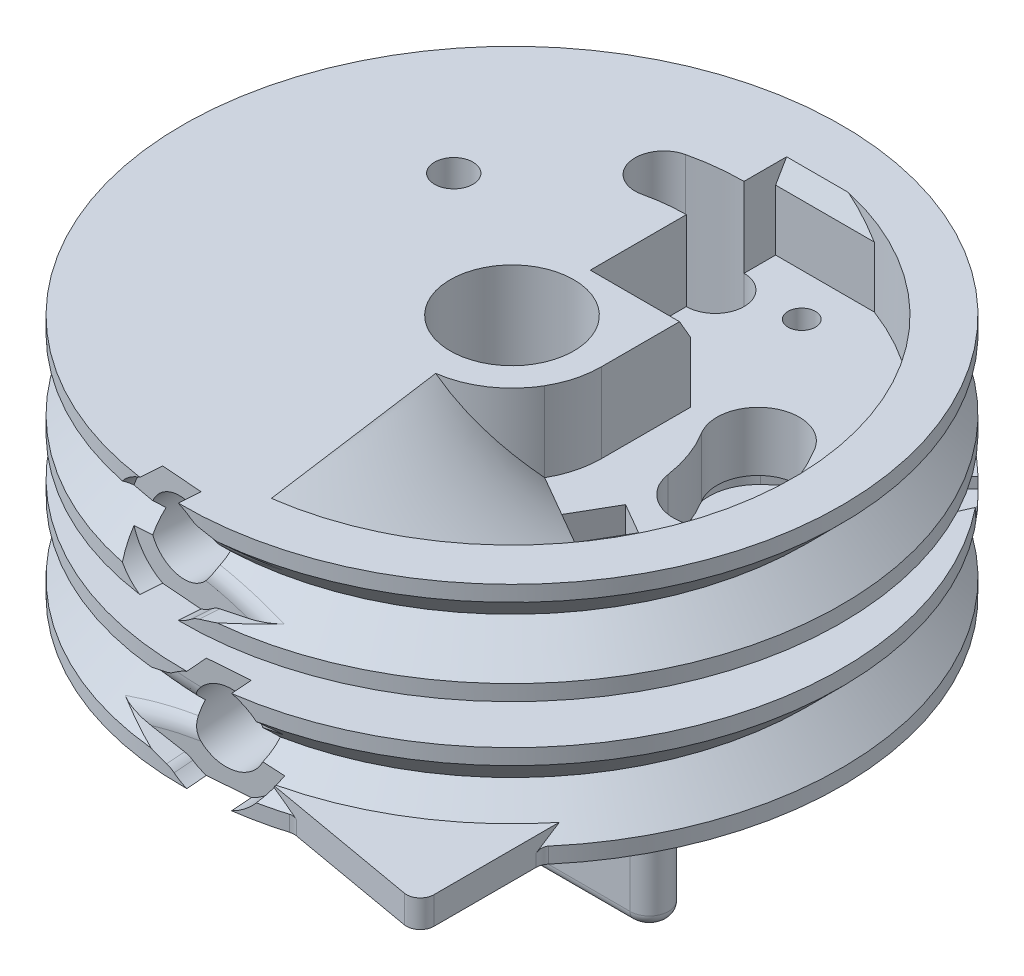
from build123d import *

# Parameters (mm, degrees)
SKETCH5_R                     = 18.25
BOSS_EXTRUDE1_DEPTH           = 2.7
FILLET1_R                     = 1.4
CUT_EXTRUDE1_DEPTH            = 3.5
SKETCH8_R                     = 1.4
CUT_EXTRUDE2_DEPTH            = 35.576870882
SKETCH9_R                     = 4.5
SLEEVE_BEARING_BORE_DEPTH     = 36.412003615
SCREW_HEAD_POCKET_DEPTH       = 36.412003615
SKETCH15_R                    = 4
WIRE_ROPE_CINCH_DEPTH         = 1.6
SKETCH16_R                    = 2.55
HEAT_SET_INSERT_HOLE_DEPTH    = 7
LIMIT_SWITCH_SLOT_DEPTH       = 36.412003779
LIMIT_START                   = -5.8
LIMIT_SWITCH_POCKET_DEPTH     = 5.8
SKETCH35_R                    = 1
LIMIT_SWITCH_HOLES_DEPTH      = 35.433123744
WIRE_RAMP_PITCH               = 40
WIRE_RAMP_HEIGHT              = 32
WIRE_RAMP_RADIUS              = 6.5
WIRE_RAMP_START_ANGLE         = 60
SKETCH36_W                    = 14
SKETCH36_H                    = 5.8
CUT_EXTRUDE17_DEPTH           = 35.433123744
CUT_EXTRUDE18_DEPTH           = 2.5
FILLET2_R                     = 1
BOSS_EXTRUDE2_DEPTH           = 5.8
CHAMFER2_SIZE                 = 0.8
CHAMFER2_SIZE2                = 1.385640646
SKETCH19_R                    = 3.1
CUT_EXTRUDE9_DEPTH            = 7.4
HOME_SWITCH_TAB_DEPTH         = 2
SKETCH17_R                    = 4
CUT_EXTRUDE7_DEPTH            = 1.6
SKETCH18_R                    = 2.55
CUT_EXTRUDE8_DEPTH            = 7
SKETCH21_R                    = 9.575
CUT_EXTRUDE13_DEPTH           = 5
SKETCH24_W                    = 1.7
SKETCH24_H                    = 23.536394427
M3_CLEARANCE_HOLE1_AT_2_COUNT = 2
M3_CLEARANCE_HOLE1_AT_2_PITCH = 8.980256121
M3_CLEARANCE_HOLE1_AT_3_COUNT = 2
M3_CLEARANCE_HOLE1_AT_3_PITCH = 12.7
M3_CLEARANCE_HOLE1_AT_4_COUNT = 2
M3_CLEARANCE_HOLE1_AT_4_PITCH = 8.980256121
SET_SCREW_HOLE_REACH          = 57.415
SET_SCREW_HOLE_END_RADIUS     = 9.575
SKETCH25_R                    = 1.7
CUT_EXTRUDE15_DEPTH           = 0.8
SKETCH27_R                    = 1.4
CUT_EXTRUDE16_DEPTH           = 37.30359691
FILLET3_R                     = 1
CUT_EXTRUDE20_DEPTH           = 54.980696213
FILLET4_R                     = 1.6
CUT_EXTRUDE21_DEPTH           = 54.980696213
FILLET5_R                     = 1.6
SKETCH45_R                    = 1.6
BOSS_EXTRUDE3_DEPTH           = 3
BOSS_EXTRUDE4_DEPTH           = 12
FILLET6_START                 = -16.3000001
FILLET6_OUTLINE_R             = 1.6
FILLET6_DEPTH                 = 3.0000001
FILLET6_START_2               = -8
FILLET6_2_DEPTH               = 16
SKETCH47_R                    = 3
CUT_EXTRUDE22_DEPTH           = 41.171238063
FILLET7_R                     = 0.8
CHAMFER5_SIZE                 = 3


with BuildPart() as part:
    # Sketch4 → Revolve1 (revolve)
    with BuildSketch(Plane(origin=(0, 0, 0), x_dir=(0, 0, -1), z_dir=(1, 0, 0))):
        Polygon((0, 0), (-24, 0), (-24, 1.138733992), (-21.438733992, 3.7), (-24, 6.261266008), (-24, 7.4), (0, 7.4), align=None)
    revolve(axis=Axis((0, 7.4, 0), (0, -1, 0)))

    # Sketch5 → Boss-Extrude1 (add)
    with BuildSketch(Plane.XZ):
        with Locations(Location((0, 0, 0), (0, 0, 270))):
            Circle(SKETCH5_R)
    extrude(amount=BOSS_EXTRUDE1_DEPTH)

    # Fillet1
    fillet1_edges = [part.edges().sort_by_distance(p)[0] for p in [
        (0, 0, 18.25),
    ]]
    fillet(fillet1_edges, radius=FILLET1_R)

    # Sketch7 → Cut-Extrude1 (cut)
    with BuildSketch(Plane.XZ.offset(2.7)):
        with BuildLine():
            Line((-14.273064383, -14.721842042), (-8.634125379, -9.480067375))
            ThreePointArc((-8.634125379, -9.480067375), (-8.991329737, -3.914860926), (-14.37293646, -5.376855059))
            Line((-14.37293646, -5.376855059), (-21.564176599, -21.4994233))
            Line((-21.564176599, -21.4994233), (-14.273064383, -14.721842042))
        make_face()
    extrude(amount=-CUT_EXTRUDE1_DEPTH, mode=Mode.SUBTRACT)

    # Sketch8 → Cut-Extrude2 (cut, through all)
    with BuildSketch(Plane.XZ.offset(-0.8)):
        with Locations(Location((-11.085159379, -6.843320833, 0), (0, 0, 270))):
            Circle(SKETCH8_R)
    extrude(amount=-CUT_EXTRUDE2_DEPTH, mode=Mode.SUBTRACT)

    # Sketch9 → sleeve bearing bore (cut, through all)
    with BuildSketch(Plane.XZ.offset(2.7)):
        with Locations(Location((0, 0, 0), (0, 0, 270))):
            Circle(SKETCH9_R)
    extrude(amount=-SLEEVE_BEARING_BORE_DEPTH, mode=Mode.SUBTRACT)

    # Sketch11 → screw head pocket (cut, through all)
    with BuildSketch(Plane.XZ.offset(2.7)):
        with BuildLine():
            ThreePointArc((13.637902876, -8.41923347), (15.058344169, -5.488365693), (15.856954091, -2.330856931))
            ThreePointArc((15.856954091, -2.330856931), (13.325138395, 1.073538652), (9.920742813, -1.458277044))
            ThreePointArc((9.920742813, -1.458277044), (9.421100599, -3.433740439), (8.532415883, -5.267408196))
            ThreePointArc((8.532415883, -5.267408196), (9.509246742, -9.396064329), (13.637902876, -8.41923347))
        make_face()
    extrude(amount=-SCREW_HEAD_POCKET_DEPTH, mode=Mode.SUBTRACT)

    # Sketch15 → Wire Rope Cinch (cut)
    with BuildSketch(Plane(origin=(-1.830283843, 0, 23.930107836), x_dir=(0.9970878265112338, 0, 0.07626182677528456), z_dir=(-0.07626182677528456, 0, 0.997087826511234))):
        with Locations((0, 3.7)):
            Circle(SKETCH15_R)
    extrude(amount=-WIRE_ROPE_CINCH_DEPTH, mode=Mode.SUBTRACT)

    # Sketch16 → Heat Set Insert Hole (cut)
    with BuildSketch(Plane(origin=(-1.70826492, 0, 22.334767314), x_dir=(0.9970878265112338, 0, 0.07626182677528458), z_dir=(-0.07626182677528458, 0, 0.997087826511234))):
        with Locations((0, 3.7)):
            Circle(SKETCH16_R)
    extrude(amount=-HEAT_SET_INSERT_HOLE_DEPTH, mode=Mode.SUBTRACT)

    # Sketch33 → Limit Switch Slot (cut, through all)
    with BuildSketch(Plane.XZ.offset(2.7)):
        with BuildLine():
            ThreePointArc((-2.879883094, -12.369166236), (-1.449411744, -12.617020472), (0, -12.7))
            ThreePointArc((0, -12.7), (2.1, -14.8), (0, -16.9))
            ThreePointArc((0, -16.9), (-1.928744762, -16.789578424), (-3.832285377, -16.459756644))
            ThreePointArc((-3.832285377, -16.459756644), (-5.40137944, -13.938260298), (-2.879883094, -12.369166236))
        make_face()
    extrude(amount=-LIMIT_SWITCH_SLOT_DEPTH, mode=Mode.SUBTRACT)

    # Sketch34 → Limit Switch Pocket (cut)
    with BuildSketch(Plane(origin=(0, 7.4, 0), x_dir=(1, 0, 0), z_dir=(0, 1, 0)).offset(LIMIT_START)):
        with BuildLine():
            Line((0, 6.5), (0, 12.7))
            ThreePointArc((0, 12.7), (-1.449411744, 12.617020472), (-2.879883094, 12.369166236))
            ThreePointArc((-2.879883094, 12.369166236), (-5.40137944, 13.938260298), (-3.832285377, 16.459756644))
            ThreePointArc((-3.832285377, 16.459756644), (-1.928744762, 16.789578424), (0, 16.9))
            Line((0, 16.9), (0, 19.2))
            Line((0, 19.2), (7.184010022, 19.2))
            ThreePointArc((7.184010022, 19.2), (19.294966587, 6.924901761), (17.753520778, -10.25))
            Line((17.753520778, -10.25), (5.629165125, -3.25))
            ThreePointArc((5.629165125, -3.25), (5.629165125, 3.25), (0, 6.5))
        make_face()
    extrude(amount=LIMIT_SWITCH_POCKET_DEPTH, mode=Mode.SUBTRACT)

    # Sketch35 → Limit Switch Holes (cut, through all)
    with BuildSketch(Plane(origin=(0, 1.6, 0), x_dir=(1, 0, 0), z_dir=(0, 1, 0))):
        with Locations(Location((5, 16.1, 0), (0, 0, 270))):
            Circle(SKETCH35_R)
    extrude(amount=-LIMIT_SWITCH_HOLES_DEPTH, mode=Mode.SUBTRACT)

    # Wire Ramp: sweep along a helix
    with BuildLine() as wire_ramp_path:
        add(Helix(WIRE_RAMP_PITCH, WIRE_RAMP_HEIGHT, WIRE_RAMP_RADIUS, center=(0, 1.6, 0), direction=(0, 1, 0), lefthand=True, mode=Mode.PRIVATE).rotate(Axis((0, 1.6, 0), (0, 1, 0)), WIRE_RAMP_START_ANGLE))
    # Sketch36 → Wire Ramp (sweep, cut)
    with BuildSketch(Plane(origin=(0, 0, 0), x_dir=(-0.8660254037844367, 0, -0.5000000000000036), z_dir=(0.5000000000000036, 0, -0.8660254037844367))):
        with Locations((-13.5, 4.5)):
            Rectangle(SKETCH36_W, SKETCH36_H)
    sweep(path=wire_ramp_path.line, is_frenet=True, mode=Mode.SUBTRACT)

    # Sketch38 → Cut-Extrude17 (cut, through all)
    with BuildSketch(Plane(origin=(0, 1.6, 0), x_dir=(1, 0, 0), z_dir=(0, 1, 0))):
        Polygon((10.825317547, -6.25), (12.525317547, -3.305513627), (10.273651497, -2.005513627), (8.573651497, -4.95), align=None)
        Polygon((14.257368355, -4.305513627), (16.509034405, -5.605513627), (14.809034405, -8.55), (12.557368355, -7.25), align=None)
    extrude(amount=-CUT_EXTRUDE17_DEPTH, mode=Mode.SUBTRACT)

    # Sketch39 → Cut-Extrude18 (cut)
    with BuildSketch(Plane.XZ.offset(2.7)):
        Polygon((12.557368355, 7.25), (10.825317547, 6.25), (12.525317547, 3.305513627), (14.257368355, 4.305513627), align=None)
    extrude(amount=-CUT_EXTRUDE18_DEPTH, mode=Mode.SUBTRACT)

    # Fillet2
    fillet2_edges = [part.edges().sort_by_distance(p)[0] for p in [
        (13.407368355, -0.2, 5.777756814),
        (11.675317547, -0.2, 4.777756814),
    ]]
    fillet(fillet2_edges, radius=FILLET2_R - 0.0001)  # a hair under: the kernel refuses the full size

    # Sketch41 → Boss-Extrude2 (add)
    with BuildSketch(Plane(origin=(0, 1.6, 0), x_dir=(1, 0, 0), z_dir=(0, 1, 0))):
        with BuildLine():
            Line((0, 6.5), (6.5, 6.5))
            Line((6.5, 6.5), (6.5, 0))
            ThreePointArc((6.5, 0), (4.596194078, 4.596194078), (0, 6.5))
        make_face()
    extrude(amount=BOSS_EXTRUDE2_DEPTH)

    # Chamfer2
    chamfer2_edges = [part.edges().sort_by_distance(p)[0] for p in [
        (3.592005011, 7.4, -19.2),
        (3.25, 7.4, -6.5),
    ]]
    chamfer2_side = [part.faces().sort_by_distance(p)[0] for p in [
        (-4.600470931, 7.4, 0.385167861),
    ]]
    chamfer(chamfer2_edges, length=CHAMFER2_SIZE, length2=CHAMFER2_SIZE2, reference=chamfer2_side[0])

    # Sketch43 → Cut-Extrude20 (cut, through all)
    with BuildSketch(Plane(origin=(-1.70826492, 0, 22.334767314), x_dir=(0.997087826511234, 0, 0.07626182677528455), z_dir=(-0.07626182677528455, 0, 0.997087826511234))):
        Polygon((10, 4.7), (10, 2.7), (0, 0), (0, 7.4), align=None)
    extrude(amount=CUT_EXTRUDE20_DEPTH, mode=Mode.SUBTRACT)

    # Fillet4
    fillet4_edges = [part.edges().sort_by_distance(p)[0] for p in [
        (3.484452903, 2.141298121, 22.731930068),
        (3.484452903, 5.258701879, 22.731930068),
        (0.897574071, 0.720615042, 23.261761405),
        (0.897574071, 6.679384958, 23.261761405),
    ]]
    fillet(fillet4_edges, radius=FILLET4_R)


with BuildPart() as body_2:
    # Sketch13 → Revolve2 (revolve)
    with BuildSketch(Plane(origin=(0, 0, 0), x_dir=(0, 0, -1), z_dir=(1, 0, 0))):
        Polygon((0, -2.9), (0, -10.3), (-24, -10.3), (-24, -9.161266008), (-21.438733992, -6.6), (-24, -4.038733992), (-24, -2.9), align=None)
    revolve(axis=Axis((0, -2.9, 0), (0, -1, 0)))

    # Sketch19 → Cut-Extrude9 (cut)
    with BuildSketch(Plane.XZ.offset(10.3)):
        with Locations(Location((0, 0, 0), (0, 0, 270))):
            Circle(SKETCH19_R)
    extrude(amount=-CUT_EXTRUDE9_DEPTH, mode=Mode.SUBTRACT)

    # Sketch42 → home switch tab (add)
    with BuildSketch(Plane.XZ.offset(10.3)):
        with BuildLine():
            Line((18, 15.874507866), (18, 24.874507866))
            Line((18, 24.874507866), (7.044720563, 22.942796521))
            Line((7.044720563, 22.942796521), (5.075105057, 22.595500165))
            ThreePointArc((5.075105057, 22.595500165), (12.215292402, 19.674855796), (18, 14.570975227))
            Line((18, 14.570975227), (18, 15.874507866))
        make_face()
    extrude(amount=-HOME_SWITCH_TAB_DEPTH)

    # Sketch17 → Cut-Extrude7 (cut)
    with BuildSketch(Plane(origin=(1.830283843, 0, 23.930107836), x_dir=(0.997087826511234, 0, -0.0762618267752854), z_dir=(0.0762618267752854, 0, 0.997087826511234))):
        with Locations((0, -6.6)):
            Circle(SKETCH17_R)
    extrude(amount=-CUT_EXTRUDE7_DEPTH, mode=Mode.SUBTRACT)

    # Sketch18 → Cut-Extrude8 (cut)
    with BuildSketch(Plane(origin=(1.70826492, 0, 22.334767314), x_dir=(0.997087826511234, 0, -0.07626182677528541), z_dir=(0.07626182677528541, 0, 0.997087826511234))):
        with Locations((0, -6.6)):
            Circle(SKETCH18_R)
    extrude(amount=-CUT_EXTRUDE8_DEPTH, mode=Mode.SUBTRACT)

    # Sketch21 → Cut-Extrude13 (cut)
    with BuildSketch(Plane.XZ.offset(2.9)):
        with Locations(Location((0, 0, 0), (0, 0, 270))):
            Circle(SKETCH21_R)
    extrude(amount=CUT_EXTRUDE13_DEPTH, mode=Mode.SUBTRACT)

    # Sketch24 → M3 Clearance Hole1 (revolve, cut)
    with BuildSketch(Plane(origin=(4.490128061, -10.3, -4.490128061), x_dir=(0, 0, -1), z_dir=(1, 0, 0))):
        with Locations((0.85, 11.768197214)):
            Rectangle(SKETCH24_W, SKETCH24_H)
    m3_clearance_hole1 = revolve(axis=Axis((4.490128061, -16.65, -4.490128061), (0, 1, 0)), mode=Mode.SUBTRACT)

    # M3 Clearance Hole1 at 2: M3 Clearance Hole1 ×2
    with Locations(*[(0, 0, i * M3_CLEARANCE_HOLE1_AT_2_PITCH) for i in range(1, M3_CLEARANCE_HOLE1_AT_2_COUNT)]):
        add(m3_clearance_hole1, mode=Mode.SUBTRACT)

    # M3 Clearance Hole1 at 3: M3 Clearance Hole1 ×2
    with Locations(*[Vector(-0.7071067811865491, 0, 0.707106781186546) * (i * M3_CLEARANCE_HOLE1_AT_3_PITCH) for i in range(1, M3_CLEARANCE_HOLE1_AT_3_COUNT)]):
        add(m3_clearance_hole1, mode=Mode.SUBTRACT)

    # M3 Clearance Hole1 at 4: M3 Clearance Hole1 ×2
    with Locations(*[(-i * M3_CLEARANCE_HOLE1_AT_4_PITCH, 0, 0) for i in range(1, M3_CLEARANCE_HOLE1_AT_4_COUNT)]):
        add(m3_clearance_hole1, mode=Mode.SUBTRACT)

    # Set Screw Hole: up to this cylinder (the profile starts outside it)
    set_screw_hole_end = Plane(origin=(0, -5.4, 0), z_dir=(0, 1, 0)) * Cylinder(SET_SCREW_HOLE_END_RADIUS, 134.98, mode=Mode.PRIVATE)
    # Sketch25 → Set Screw Hole (cut, up to the surface)
    with BuildSketch(Plane(origin=(0, 0, -24), x_dir=(-1, 0, 0), z_dir=(0, 0, -1)), mode=Mode.PRIVATE) as set_screw_hole_sk1:
        with Locations(Location((0, -5.4, 0), (0, 0, 90))):
            Circle(SKETCH25_R)
    set_screw_hole_tool1 = extrude(set_screw_hole_sk1.sketch, amount=-SET_SCREW_HOLE_REACH, mode=Mode.PRIVATE) - set_screw_hole_end
    add(set_screw_hole_tool1.solids().sort_by_distance((0, -5.4, -24))[0], mode=Mode.SUBTRACT)

    # Sketch26 → Cut-Extrude15 (cut)
    with BuildSketch(Plane(origin=(0, -2.9, 0), x_dir=(1, 0, 0), z_dir=(0, 1, 0))):
        with BuildLine():
            Line((14.37293646, 5.376855059), (21.564176599, 21.4994233))
            Line((21.564176599, 21.4994233), (8.634125379, 9.480067375))
            ThreePointArc((8.634125379, 9.480067375), (8.991329737, 3.914860926), (14.37293646, 5.376855059))
        make_face()
    extrude(amount=-CUT_EXTRUDE15_DEPTH, mode=Mode.SUBTRACT)

    # Sketch27 → Cut-Extrude16 (cut, through all)
    with BuildSketch(Plane(origin=(0, -3.7, 0), x_dir=(1, 0, 0), z_dir=(0, 1, 0))):
        with Locations(Location((11.085159379, 6.843320833, 0), (0, 0, 270))):
            Circle(SKETCH27_R)
    extrude(amount=-CUT_EXTRUDE16_DEPTH, mode=Mode.SUBTRACT)

    # Fillet3
    fillet3_edges = [body_2.edges().sort_by_distance(p)[0] for p in [
        (7.044720563, -9.730633004, 22.942796521),
        (18, -9.730633004, 15.874507866),
        (18, -9.3, 24.874507866),
    ]]
    fillet(fillet3_edges, radius=FILLET3_R)

    # Sketch44 → Cut-Extrude21 (cut, through all)
    with BuildSketch(Plane(origin=(1.70826492, 0, 22.334767314), x_dir=(0.9970878265112338, 0, -0.0762618267752854), z_dir=(0.0762618267752854, 0, 0.9970878265112338))):
        Polygon((-10, -7.6), (-10, -5.6), (0, -2.9), (0, -10.3), align=None)
    extrude(amount=CUT_EXTRUDE21_DEPTH, mode=Mode.SUBTRACT)

    # Fillet5
    fillet5_edges = [body_2.edges().sort_by_distance(p)[0] for p in [
        (-0.897574071, -9.579384958, 23.261761405),
        (-3.484452903, -8.158701879, 22.731930068),
        (-3.484452903, -5.041298121, 22.731930068),
        (-0.897574071, -3.620615042, 23.261761405),
    ]]
    fillet(fillet5_edges, radius=FILLET5_R)


with BuildPart() as body_3:
    # Sketch45 → Boss-Extrude3 (new body)
    with BuildSketch(Plane.XZ.offset(10.3)):
        with BuildLine():
            Line((2.368807717, 6.611448404), (-6.611448404, -2.368807717))
            ThreePointArc((-6.611448404, -2.368807717), (-6.611448404, -6.611448404), (-2.368807717, -6.611448404))
            Line((-2.368807717, -6.611448404), (6.611448404, 2.368807717))
            ThreePointArc((6.611448404, 2.368807717), (6.611448404, 6.611448404), (2.368807717, 6.611448404))
        make_face()
        with Locations(Location((4.490128061, 4.490128061, 0), (0, 0, 270))):
            Circle(SKETCH45_R, mode=Mode.SUBTRACT)
        with Locations(Location((-4.490128061, -4.490128061, 0), (0, 0, 270))):
            Circle(SKETCH45_R, mode=Mode.SUBTRACT)
    extrude(amount=BOSS_EXTRUDE3_DEPTH)

    # Sketch46 → Boss-Extrude4 (add)
    with BuildSketch(Plane.XZ.offset(13.3)):
        with BuildLine():
            Line((-10, 1.4), (10, 1.4))
            ThreePointArc((10, 1.4), (11.4, 0), (10, -1.4))
            Line((10, -1.4), (-10, -1.4))
            ThreePointArc((-10, -1.4), (-11.4, 0), (-10, 1.4))
        make_face()
    extrude(amount=BOSS_EXTRUDE4_DEPTH)

    # Fillet6: read off the stored shape, not the designer's step
    # Fillet6 outline → Fillet6 (add)
    # profile 1 of 2: a face of its own
    with BuildSketch(Plane(origin=(0, 0, 0), x_dir=(1, 0, 0), z_dir=(0, 1, 0)).offset(FILLET6_START)):
        with BuildLine():
            Line((-2.842640687, -1.4), (2.368807717, -6.611448404))
            ThreePointArc((2.368807717, -6.611448404), (6.611448404, -6.611448404), (6.611448404, -2.368807717))
            Line((6.611448404, -2.368807717), (5.642640687, -1.4))
            Line((5.642640687, -1.4), (-2.842640687, -1.4))
        make_face()
        with Locations((4.490128061, -4.490128061)):
            Circle(FILLET6_OUTLINE_R, mode=Mode.SUBTRACT)
    # profile 2 of 2: a face of its own
    with BuildSketch(Plane(origin=(0, 0, 0), x_dir=(1, 0, 0), z_dir=(0, 1, 0)).offset(FILLET6_START)):
        with BuildLine():
            Line((-6.611448404, 2.368807717), (-5.642640687, 1.4))
            Line((-5.642640687, 1.4), (2.842640687, 1.4))
            Line((2.842640687, 1.4), (-2.368807717, 6.611448404))
            ThreePointArc((-2.368807717, 6.611448404), (-6.611448404, 6.611448404), (-6.611448404, 2.368807717))
        make_face()
        with Locations((-4.490128061, 4.490128061)):
            Circle(FILLET6_OUTLINE_R, mode=Mode.SUBTRACT)
    extrude(amount=FILLET6_DEPTH)

    # Fillet6 2 outline → Fillet6 2 (cut)
    with BuildSketch(Plane.YZ.offset(FILLET6_START_2)):
        with BuildLine():
            Line((-13.3, 4.4), (-13.3, 9))
            Line((-13.3, 9), (-16.3000001, 9))
            Line((-16.3000001, 9), (-16.3, 1.4))
            ThreePointArc((-16.3, 1.4), (-14.178679656, 2.278679656), (-13.3, 4.4))
        make_face()
        with BuildLine():
            Line((-16.3000001, -9), (-13.3, -9))
            Line((-13.3, -9), (-13.3, -4.4))
            ThreePointArc((-13.3, -4.4), (-14.178679656, -2.278679656), (-16.3, -1.4))
            Line((-16.3, -1.4), (-16.3000001, -9))
        make_face()
    extrude(amount=FILLET6_2_DEPTH, mode=Mode.SUBTRACT)

    # Sketch47 → Cut-Extrude22 (cut, through all)
    with BuildSketch(Plane.XZ.offset(13.3)):
        with Locations((-4.490128061, -4.490128061)):
            Circle(SKETCH47_R)
        with Locations((4.490128061, 4.490128061)):
            Circle(SKETCH47_R)
    extrude(amount=CUT_EXTRUDE22_DEPTH, mode=Mode.SUBTRACT)

    # Fillet7
    fillet7_edges = [body_3.edges().sort_by_distance(p)[0] for p in [
        (-11.4, -25.3, 0),
        (0, -25.3, -1.4),
        (11.4, -25.3, 0),
        (0, -25.3, 1.4),
    ]]
    fillet(fillet7_edges, radius=FILLET7_R)

    # Chamfer5
    # the kernel refuses this chamfer: 3 mm, written as the material it adds along each edge
    with BuildSketch(Plane(origin=(2.612722752, -13.3, 6.85536344), x_dir=(-0.7071067811865489, 0, 0.707106781186546), z_dir=(-0.7071067811865461, 0, -0.707106781186549))) as chamfer5_piece_1_section:
        Polygon((CHAMFER5_SIZE, 0), (0, CHAMFER5_SIZE), (0, 0), align=None)
    chamfer5_piece_1 = extrude(amount=19.389895902, mode=Mode.PRIVATE)
    chamfer5_piece_1 = split(chamfer5_piece_1, bisect_by=Plane(origin=(2.612722752, -13.3, 1.4), z_dir=(0, 0, -1)), keep=Keep.TOP, mode=Mode.PRIVATE)
    chamfer5_piece_1 = split(chamfer5_piece_1, bisect_by=Plane(origin=(2.612722752, -13.3, -1.4), z_dir=(0, 0, 1)), keep=Keep.TOP, mode=Mode.PRIVATE)
    add(chamfer5_piece_1)
    with BuildSketch(Plane(origin=(-2.612722752, -13.3, -6.85536344), x_dir=(0.7071067811865489, 0, -0.7071067811865462), z_dir=(0.7071067811865462, 0, 0.7071067811865489))) as chamfer5_piece_2_section:
        Polygon((CHAMFER5_SIZE, 0), (0, CHAMFER5_SIZE), (0, 0), align=None)
    chamfer5_piece_2 = extrude(amount=19.389895902, mode=Mode.PRIVATE)
    chamfer5_piece_2 = split(chamfer5_piece_2, bisect_by=Plane(origin=(-2.612722752, -13.3, 1.4), z_dir=(0, 0, -1)), keep=Keep.TOP, mode=Mode.PRIVATE)
    chamfer5_piece_2 = split(chamfer5_piece_2, bisect_by=Plane(origin=(-2.612722752, -13.3, -1.4), z_dir=(0, 0, 1)), keep=Keep.TOP, mode=Mode.PRIVATE)
    add(chamfer5_piece_2)


solid = Compound([part.part, body_2.part, body_3.part])
